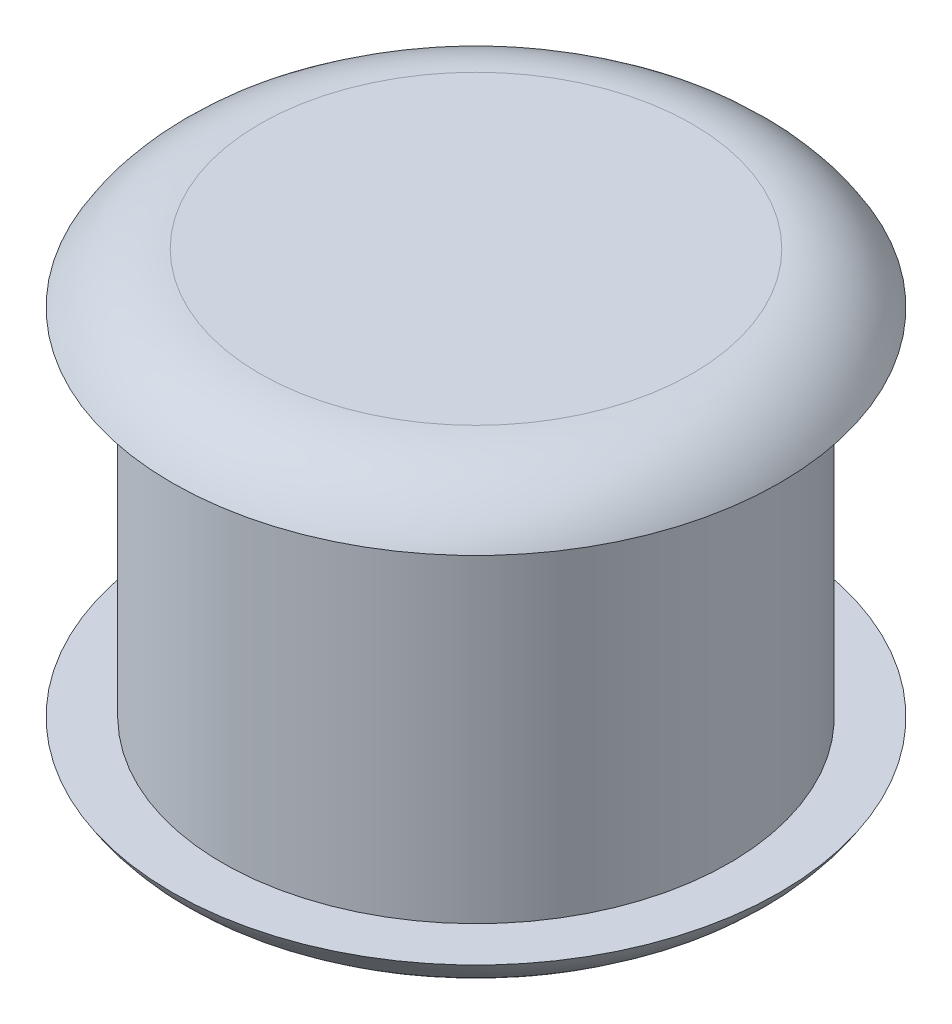
from build123d import *

# Parameters (mm, degrees)
FILLET1_R    = 101.6
SCALE1_SCALE = 0.214285714


with BuildPart() as part:
    # Sketch2 → Revolve1 (revolve)
    with BuildSketch(Plane.XY, mode=Mode.PRIVATE) as revolve1_sk:
        Polygon((0, 0), (304.8, 0), (304.8, -50.8), (254, -50.8), (254, -406.4), (304.8, -406.4), (304.8, -457.2), (0, -457.2), align=None)
    revolve(revolve1_sk.sketch.rotate(Axis((0, -457.2, 0), (0, 1, 0)), 90), axis=Axis((0, -457.2, 0), (0, 1, 0)))

    # Fillet1
    # the kernel refuses this fillet: 101.6 mm, written as the material it takes off along each edge
    with BuildSketch(Plane(origin=(0, -457.2, 0), x_dir=(0, 0, -1), z_dir=(1, 0, 0))) as fillet1_piece_1:
        with BuildLine():
            CenterArc((216.811818975, 101.6), FILLET1_R, 270, 60)
            Line((216.811818975, 0), (216.811818975, -2.032))
            Line((216.811818975, -2.032), (304.8, -2.032))
            Line((304.8, -2.032), (306.832, 0))
            ThreePointArc((306.832, 0), (306.832, 25.4), (306.55976362, 49.784))
            Line((306.55976362, 49.784), (304.8, 50.8))
        make_face()
    revolve(axis=Axis((0, -457.2, 0), (0, 1, 0)), mode=Mode.SUBTRACT)
    with BuildSketch(Plane(origin=(0, 0, 0), x_dir=(0, 0, -1), z_dir=(1, 0, 0))) as fillet1_piece_2:
        with BuildLine():
            CenterArc((216.811818975, -101.6), FILLET1_R, 30, 60)
            Line((304.8, -50.8), (306.55976362, -49.784))
            ThreePointArc((306.55976362, -49.784), (306.832, -25.4), (306.832, 0))
            Line((306.832, 0), (304.8, 2.032))
            Line((304.8, 2.032), (216.811818975, 2.032))
            Line((216.811818975, 2.032), (216.811818975, 0))
        make_face()
    revolve(axis=Axis((0, 0, 0), (0, 1, 0)), mode=Mode.SUBTRACT)


with BuildPart() as part_1:
    # Scale1: scaled about (0, -228.6, 0)
    add(part.part.scale(SCALE1_SCALE).moved(Location((0, -179.614285714, 0))))


solid = part_1.part
